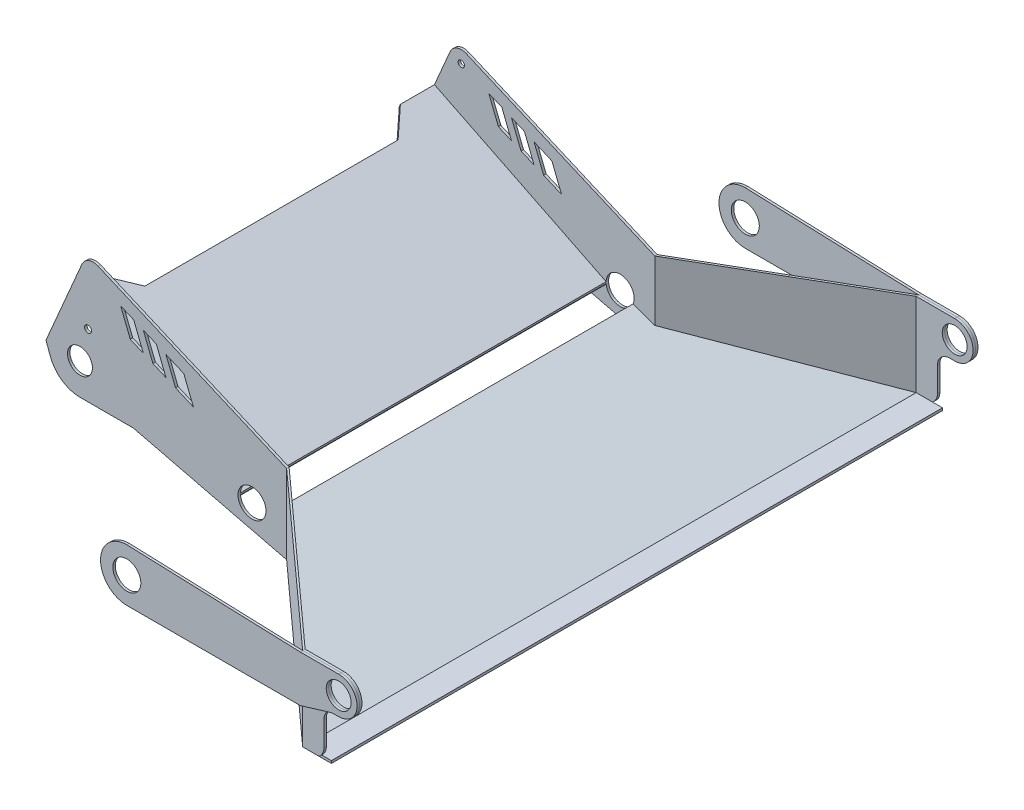
from build123d import *

# Parameters (mm, degrees)
BOSS_EXTRUDE2_START                = 190.5
BOSS_EXTRUDE2_DEPTH                = 2.54
VENT1_START                        = 3.81
VENT1_DEPTH                        = 2.54
FILLET3_R                          = 12.7
EXTRUDE_THIN3_DEPTH                = 378.46
FILLET4_R                          = 12.7
SKETCH6_W                          = 14.48562
SKETCH6_H                          = 383.54
F_1_1_8_CLEARANCE_HOLE1_AT_2_COUNT = 2
F_1_1_8_CLEARANCE_HOLE1_AT_2_PITCH = 219.269341855
SKETCH8_W                          = 12.89812
SKETCH8_H                          = 383.54
CUT_EXTRUDE3_START                 = -2.54
SKETCH13_R                         = 14.48562
CUT_EXTRUDE3_DEPTH                 = 2.54
BOSS_EXTRUDE3_DEPTH                = 2.54
BOSS_EXTRUDE4_DEPTH                = 127
BOSS_EXTRUDE5_DEPTH                = 2.54
BOSS_EXTRUDE11_DEPTH               = 2.54
BOSS_EXTRUDE7_DEPTH                = 2.54
BOSS_EXTRUDE8_DEPTH                = 127
SKETCH22_W                         = 12.89812
SKETCH22_H                         = 637.540025
SKETCH24_R                         = 12.89812
SKETCH24_R_2                       = 14.48562
BOSS_EXTRUDE9_DEPTH                = 2.54
CUT_EXTRUDE4_DEPTH                 = 821.847958154
SKETCH28_W                         = 3.2639
SKETCH28_H                         = 132.08
SKETCH35_W                         = 3.57124
SKETCH35_H                         = 513.08


# Read off the part's stored shape, not the designer's step: Vent1, Extrude-Thin3
with BuildPart() as part:
    # Sketch2 → Boss-Extrude2 (new body)
    with BuildSketch(Plane(origin=(0, 0, 196.85), x_dir=(-1, 0, 0), z_dir=(0, 0, -1)).offset(BOSS_EXTRUDE2_START)):
        with BuildLine():
            Line((-349.25, 76.2), (-293.869593793, 76.2))
            ThreePointArc((-293.869593793, 76.2), (-275.358317793, 81.948712351), (-263.360009608, 97.172234727))
            Line((-263.360009608, 97.172234727), (-263.354358358, 97.173614624))
            Line((-263.354358358, 97.173614624), (-258.731847293, 109.870467716))
            Line((-258.731847293, 109.870467716), (-300.924476703, 208.123354944))
            Line((-300.924476703, 208.123354944), (-572.64199408, 91.44))
            Line((-572.64199408, 91.44), (-691.190143255, 91.44))
            ThreePointArc((-691.190143255, 91.44), (-710.240143255, 72.39), (-691.190143255, 53.34))
            Line((-691.190143255, 53.34), (-673.350620795, 53.34))
            Line((-673.350620795, 53.34), (-673.350620795, 2.54))
            Line((-673.350620795, 2.54), (-650.918218697, 2.54))
            Line((-650.918218697, 2.54), (-349.25, 76.2))
        make_face()
    extrude(amount=BOSS_EXTRUDE2_DEPTH)

    # Vent1 outline → Vent1 (cut)
    with BuildSketch(Plane.XY.offset(VENT1_START)):
        Polygon((312.53372146, 189.316528007), (322.521154182, 164.295413171), (336.053768002, 158.484117687), (326.06633528, 183.505232523), align=None)
        Polygon((335.968247831, 179.253065095), (345.955680553, 154.23195026), (359.488294373, 148.420654776), (349.500861651, 173.441769611), align=None)
        Polygon((359.402774202, 169.189602184), (369.390206924, 144.168487348), (382.922820744, 138.357191864), (372.935388022, 163.3783067), align=None)
        Polygon((382.837300573, 159.126139273), (392.824733295, 134.105024437), (411.308303391, 126.167645239), (401.320870668, 151.188760075), align=None)
        Polygon((305.456681471, 186.491655445), (300.065924128, 173.938337941), (312.619241631, 168.547580599), align=None)
    extrude(amount=VENT1_DEPTH, mode=Mode.SUBTRACT)

    # Fillet3
    fillet3_edges = [part.edges().sort_by_distance(p)[0] for p in [
        (673.350620795, 2.54, 5.08),
        (673.350620795, 53.34, 5.08),
    ]]
    fillet(fillet3_edges, radius=FILLET3_R)


with BuildPart() as body_2:
    # Body-Move/Copy1: copy of part
    add(part.part.moved(Location((0, 0, 381))))


with BuildPart() as body_3:
    # Extrude-Thin3 outline → Extrude-Thin3 (new body)
    with BuildSketch(Plane.XY.offset(6.35)):
        Polygon((463.803208288, 70.316223369), (650.918218697, 2.54), (678.552714292, 2.54), (678.552714292, 5.08), (651.364061001, 5.08), (464.668241028, 72.704385499), align=None)
        Polygon((458.179736182, 70.734229025), (279.770453085, 158.862526074), (278.645535089, 156.585211976), (457.054818185, 68.456914927), align=None)
    extrude(amount=EXTRUDE_THIN3_DEPTH)


with BuildPart() as part_1:
    add(part.part)

    # Fillet4
    fillet4_edges = [part_1.edges().sort_by_distance(p)[0] for p in [
        (300.924476703, 208.123354944, 5.08),
    ]]
    fillet(fillet4_edges, radius=FILLET4_R)


with BuildPart() as f_1_1_8_clearance_hole1_tool:
    # Sketch6 → 1-1/8 Clearance Hole1 (revolve)
    with BuildSketch(Plane(origin=(691.190143255, 72.39, 387.35), x_dir=(0, -1, 0), z_dir=(1, 0, 0))):
        with Locations((7.24281, 191.77)):
            Rectangle(SKETCH6_W, SKETCH6_H)
    f_1_1_8_clearance_hole1 = revolve(axis=Axis((691.190143255, 72.39, 393.7), (0, 0, -1)))


with BuildPart() as part_2:
    add(part_1.part)

    # 1-1/8 Clearance Hole1: cut by f_1_1_8_clearance_hole1_tool
    add(f_1_1_8_clearance_hole1_tool.part, mode=Mode.SUBTRACT)


with BuildPart() as body_2_1:
    add(body_2.part)

    # 1-1/8 Clearance Hole1: cut by f_1_1_8_clearance_hole1_tool
    add(f_1_1_8_clearance_hole1_tool.part, mode=Mode.SUBTRACT)


with BuildPart() as f_1_1_8_clearance_hole1_at_2_tool:
    # 1-1/8 Clearance Hole1 at 2: 1-1/8 Clearance Hole1 ×2
    with Locations(*[Vector(-0.9999662638682391, -0.00821408092213147, 0) * (i * F_1_1_8_CLEARANCE_HOLE1_AT_2_PITCH) for i in range(1, F_1_1_8_CLEARANCE_HOLE1_AT_2_COUNT)]):
        add(f_1_1_8_clearance_hole1)


with BuildPart() as part_3:
    add(part_2.part)

    # 1-1/8 Clearance Hole1 at 2: cut by f_1_1_8_clearance_hole1_at_2_tool
    add(f_1_1_8_clearance_hole1_at_2_tool.part, mode=Mode.SUBTRACT)


with BuildPart() as body_2_2:
    add(body_2_1.part)

    # 1-1/8 Clearance Hole1 at 2: cut by f_1_1_8_clearance_hole1_at_2_tool
    add(f_1_1_8_clearance_hole1_at_2_tool.part, mode=Mode.SUBTRACT)


with BuildPart() as body_3_1:
    add(body_3.part)

    # 1-1/8 Clearance Hole1 at 2: cut by f_1_1_8_clearance_hole1_at_2_tool
    add(f_1_1_8_clearance_hole1_at_2_tool.part, mode=Mode.SUBTRACT)

    # Sketch10 → Boss-Extrude3 (add)
    with BuildSketch(Plane(origin=(77.174379507, 213.061219806, 0), x_dir=(0.9402213111169273, -0.34056407050886367, 0), z_dir=(0.34056407050886367, 0.9402213111169273, 0))):
        Polygon((610.696305971, 120.65), (458.107928239, -6.35), (464.664381949, -6.35), (610.696305971, -6.35), align=None)
    extrude(amount=-BOSS_EXTRUDE3_DEPTH)

    # Sketch15 → Boss-Extrude4 (add)
    with BuildSketch(Plane(origin=(0, 0, 6.35), x_dir=(-1, 0, 0), z_dir=(0, 0, -1))):
        Polygon((-650.918218697, 2.54), (-650.499028262, 2.69183787), (-651.364061001, 5.08), (-678.552714292, 5.08), (-678.552714292, 2.54), align=None)
    extrude(amount=BOSS_EXTRUDE4_DEPTH)



with BuildPart() as f_1_clearance_hole1_tool:
    # Sketch8 → 1 Clearance Hole1 (revolve)
    with BuildSketch(Plane(origin=(293.869593793, 108.878190342, 387.35), x_dir=(0, -1, 0), z_dir=(1, 0, 0))):
        with Locations((6.44906, 191.77)):
            Rectangle(SKETCH8_W, SKETCH8_H)
    revolve(axis=Axis((293.869593793, 108.878190342, 393.7), (0, 0, -1)))


with BuildPart() as part_4:
    add(part_3.part)

    # 1 Clearance Hole1: cut by f_1_clearance_hole1_tool
    add(f_1_clearance_hole1_tool.part, mode=Mode.SUBTRACT)

    # Sketch13 → Cut-Extrude3 (cut)
    # profile 1 of 3: a face of its own
    with BuildSketch(Plane.XY.offset(6.35).offset(CUT_EXTRUDE3_START)):
        Polygon((507.786685374, 37.489219345), (650.918218697, 2.54), (507.786685374, 105.764971846), align=None)
    # profile 2 of 3: a face of its own
    with BuildSketch(Plane.XY.offset(6.35).offset(CUT_EXTRUDE3_START)):
        with BuildLine():
            Line((507.786685374, 105.764971846), (650.918218697, 2.54))
            Line((650.918218697, 2.54), (660.650620795, 2.54))
            ThreePointArc((660.650620795, 2.54), (669.630876916, 6.259743879), (673.350620795, 15.24))
            Line((673.350620795, 15.24), (673.350620795, 40.64))
            ThreePointArc((673.350620795, 40.64), (677.070364674, 49.620256121), (686.050620795, 53.34))
            Line((686.050620795, 53.34), (691.190143255, 53.34))
            ThreePointArc((691.190143255, 53.34), (710.240143255, 72.39), (691.190143255, 91.44))
            Line((691.190143255, 91.44), (572.64199408, 91.44))
            Line((572.64199408, 91.44), (507.786685374, 119.290743959))
            Line((507.786685374, 119.290743959), (507.786685374, 105.764971846))
        make_face()
        with Locations(Location((691.190143255, 72.39, 0), (0, 0, 270))):
            Circle(SKETCH13_R, mode=Mode.SUBTRACT)
    # profile 3 of 3: a face of its own
    with BuildSketch(Plane.XY.offset(6.35).offset(CUT_EXTRUDE3_START)):
        with BuildLine():
            Line((660.650620795, 2.54), (650.918218697, 2.54))
            Line((650.918218697, 2.54), (507.786685374, 37.489219345))
            Line((507.786685374, 37.489219345), (507.786685374, 32.312256985))
            Line((507.786685374, 32.312256985), (691.190143255, -16.865030172))
            Line((691.190143255, -16.865030172), (673.350620795, 15.24))
            ThreePointArc((673.350620795, 15.24), (669.630876916, 6.259743879), (660.650620795, 2.54))
        make_face()
    extrude(amount=CUT_EXTRUDE3_DEPTH, mode=Mode.SUBTRACT)

    # Sketch26 → Boss-Extrude11 (add)
    with BuildSketch(Plane.XY.offset(6.35)):
        Polygon((305.456681471, 186.491655445), (300.065924128, 173.938337941), (312.619241631, 168.547580599), align=None)
        Polygon((326.06633528, 183.505232523), (312.53372146, 189.316528007), (322.521154182, 164.295413171), (336.053768002, 158.484117687), align=None)
    extrude(amount=-BOSS_EXTRUDE11_DEPTH)


with BuildPart() as body_2_3:
    add(body_2_2.part)

    # 1 Clearance Hole1: cut by f_1_clearance_hole1_tool
    add(f_1_clearance_hole1_tool.part, mode=Mode.SUBTRACT)


with BuildPart() as body_4:
    # Sketch16 → Boss-Extrude5 (new body)
    with BuildSketch(Plane(origin=(0, 0, -120.65), x_dir=(-1, 0, 0), z_dir=(0, 0, -1))):
        with BuildLine():
            Line((-668.270620795, 5.08), (-651.364061001, 5.08))
            Line((-651.364061001, 5.08), (-651.364061001, 91.44))
            Line((-651.364061001, 91.44), (-691.190143255, 91.44))
            ThreePointArc((-691.190143255, 91.44), (-710.240143255, 72.39), (-691.190143255, 53.34))
            Line((-691.190143255, 53.34), (-686.050620795, 53.34))
            ThreePointArc((-686.050620795, 53.34), (-677.070364674, 49.620256121), (-673.350620795, 40.64))
            Line((-673.350620795, 40.64), (-673.350620795, 15.24))
            ThreePointArc((-673.350620795, 15.24), (-672.009846121, 9.560387337), (-668.270620795, 5.08))
        make_face()
    extrude(amount=BOSS_EXTRUDE5_DEPTH)

    # Sketch17 → Loft1 section 0
    with BuildSketch(Plane(origin=(507.786685374, 433.92918903, 0), x_dir=(0, 0, -1), z_dir=(1, 0, 0))):
        with BuildLine():
            Line((-6.35, -396.439969685), (-3.81, -396.439969685))
            Line((-3.81, -396.439969685), (-3.81, -314.63844507))
            Line((-3.81, -314.63844507), (-6.35, -314.63844507))
            Line((-6.35, -314.63844507), (-6.35, -396.439969685))
        make_face()
    # Sketch18 → Loft1 section 1
    with BuildSketch(Plane.ZY.offset(-651.364061001)):
        with BuildLine():
            Line((-120.65, 5.08), (-120.65, 91.44))
            Line((-120.65, 91.44), (-123.19, 91.44))
            Line((-123.19, 91.44), (-123.19, 5.08))
            Line((-123.19, 5.08), (-120.65, 5.08))
        make_face()
    loft()


with BuildPart() as body_4_2:
    # Mirror2: mirrored copy
    add(body_4.part.mirror(Plane.XY.offset(195.58)))


with BuildPart() as body_5:
    # Mirror2 2: mirrored copy
    add(part_4.part.mirror(Plane.XY.offset(195.58)))


with BuildPart() as body_3_2:
    add(body_3_1.part)

    add(body_4_2.part)  # Boss-Extrude7 merges body 4 2
    # Sketch19 → Boss-Extrude7 (add)
    with BuildSketch(Plane(origin=(77.174379507, 213.061219806, 0), x_dir=(0.9402213111169273, -0.34056407050886367, 0), z_dir=(0.34056407050886367, 0.9402213111169273, 0))):
        Polygon((464.664381949, -384.81), (610.696305971, -511.81), (610.696305971, -384.81), align=None)
    extrude(amount=-BOSS_EXTRUDE7_DEPTH)

    # Sketch20 → Boss-Extrude8 (add)
    with BuildSketch(Plane.XY.offset(384.81)):
        Polygon((650.918218697, 2.54), (678.552714292, 2.54), (678.552714292, 5.08), (651.364061001, 5.08), (650.499028262, 2.69183787), align=None)
    extrude(amount=BOSS_EXTRUDE8_DEPTH)


with BuildPart() as f_1_clearance_hole2_tool:
    # Sketch22 → 1 Clearance Hole2 (revolve)
    with BuildSketch(Plane(origin=(691.190143255, 72.39, 514.35), x_dir=(0, -1, 0), z_dir=(1, 0, 0))):
        with Locations((6.44906, 318.7700125)):
            Rectangle(SKETCH22_W, SKETCH22_H)
    revolve(axis=Axis((691.190143255, 72.39, 520.7), (0, 0, -1)))


with BuildPart() as body_3_3:
    add(body_3_2.part)

    # 1 Clearance Hole2: cut by f_1_clearance_hole2_tool
    add(f_1_clearance_hole2_tool.part, mode=Mode.SUBTRACT)

    # Sketch25 → Cut-Extrude4 (cut, through all)
    with BuildSketch(Plane(origin=(117.956095946, 238.793477454, 0), x_dir=(0.8965803535519616, -0.4428811010018824, 0), z_dir=(0.4428811010018824, 0.8965803535519616, 0))):
        Polygon((180.479481285, -41.605609291), (180.479481285, -195.58), (203.429210289, -195.58), (203.429210289, -64.555338295), align=None)
        Polygon((203.429210289, -195.58), (180.479481285, -195.58), (180.479481285, -349.554390709), (203.429210289, -326.604661705), align=None)
    extrude(amount=-CUT_EXTRUDE4_DEPTH, mode=Mode.SUBTRACT)


with BuildPart() as body_4_1:
    add(body_4.part)

    # 1 Clearance Hole2: cut by f_1_clearance_hole2_tool
    add(f_1_clearance_hole2_tool.part, mode=Mode.SUBTRACT)


with BuildPart() as body_5_2:
    # Sketch24 → Boss-Extrude9 (new body)
    # profile 1 of 3: a face of its own
    with BuildSketch(Plane(origin=(0, 0, -123.19), x_dir=(-1, 0, 0), z_dir=(0, 0, -1))):
        with BuildLine():
            ThreePointArc((-471.9281987, 43.403283882), (-499.096894311, 69.629782617), (-473.845247029, 97.706847397))
            Line((-473.845247029, 97.706847397), (-651.364061001, 91.44))
            Line((-651.364061001, 91.44), (-651.364061001, 43.403283882))
            Line((-651.364061001, 43.403283882), (-471.9281987, 43.403283882))
        make_face()
    # profile 2 of 3: a face of its own
    with BuildSketch(Plane(origin=(0, 0, -123.19), x_dir=(-1, 0, 0), z_dir=(0, 0, -1))):
        with BuildLine():
            Line((-651.364061001, 43.403283882), (-651.364061001, 91.44))
            Line((-651.364061001, 91.44), (-691.190143255, 91.44))
            ThreePointArc((-691.190143255, 91.44), (-710.240143255, 72.39), (-691.190143255, 53.34))
            Line((-691.190143255, 53.34), (-686.050620795, 53.34))
            ThreePointArc((-686.050620795, 53.34), (-684.189717833, 53.202923233), (-682.368985983, 52.794651995))
            Line((-682.368985983, 52.794651995), (-651.364061001, 43.403283882))
        make_face()
        with Locations((-691.190143255, 72.39)):
            Circle(SKETCH24_R, mode=Mode.SUBTRACT)
    # profile 3 of 3: a face of its own
    with BuildSketch(Plane(origin=(0, 0, -123.19), x_dir=(-1, 0, 0), z_dir=(0, 0, -1))):
        with BuildLine():
            ThreePointArc((-444.7425787, 70.588903882), (-452.705062447, 89.812040135), (-471.9281987, 97.774523882))
            Line((-471.9281987, 97.774523882), (-473.845247029, 97.706847397))
            ThreePointArc((-473.845247029, 97.706847397), (-499.096894311, 69.629782617), (-471.9281987, 43.403283882))
            ThreePointArc((-471.9281987, 43.403283882), (-452.705062447, 51.36576763), (-444.7425787, 70.588903882))
        make_face()
        with Locations((-471.9281987, 70.588903882)):
            Circle(SKETCH24_R_2, mode=Mode.SUBTRACT)
    extrude(amount=BOSS_EXTRUDE9_DEPTH)


with BuildPart() as body_6:
    # Mirror3: mirrored copy
    add(body_5_2.part.mirror(Plane.XY.offset(195.58)))


with BuildPart() as part_5:
    add(part_4.part)

    # Sketch28 → 1/4 Clearance Hole1 (revolve, cut)
    with BuildSketch(Plane(origin=(307.582765184, 191.44261172, 6.35), x_dir=(0, -1, 0), z_dir=(1, 0, 0))):
        with Locations((1.63195, 66.04)):
            Rectangle(SKETCH28_W, SKETCH28_H)
    revolve(axis=Axis((307.582765184, 191.44261172, 12.7), (0, 0, -1)), mode=Mode.SUBTRACT)


with BuildPart() as f_1_4_clearance_hole3_tool:
    # Sketch35 → 1/4 Clearance Hole3 (revolve)
    with BuildSketch(Plane(origin=(302.269794085, 141.468340304, 387.35), x_dir=(0, -1, 0), z_dir=(1, 0, 0))):
        with Locations((1.78562, 256.54)):
            Rectangle(SKETCH35_W, SKETCH35_H)
    revolve(axis=Axis((302.269794085, 141.468340304, 393.7), (0, 0, -1)))


with BuildPart() as part_6:
    add(part_5.part)

    # 1/4 Clearance Hole3: cut by f_1_4_clearance_hole3_tool
    add(f_1_4_clearance_hole3_tool.part, mode=Mode.SUBTRACT)


with BuildPart() as body_5_1:
    add(body_5.part)

    # 1/4 Clearance Hole3: cut by f_1_4_clearance_hole3_tool
    add(f_1_4_clearance_hole3_tool.part, mode=Mode.SUBTRACT)


solid = Compound([body_3_3.part, body_4_1.part, body_5_2.part, body_6.part, part_6.part, body_5_1.part])
